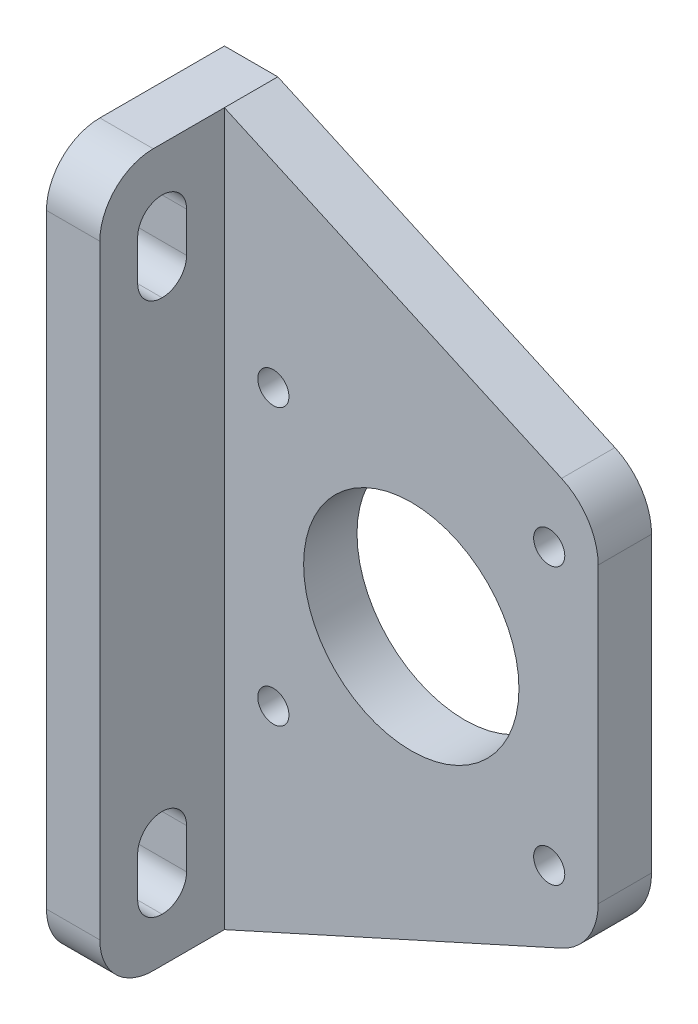
from build123d import *

# Parameters (mm, degrees)
SKETCH1_R           = 12.1
SKETCH1_R_2         = 1.75
BOSS_EXTRUDE1_DEPTH = 6
SKETCH2_R           = 3.25
CUT_EXTRUDE1_DEPTH  = 3.5
FILLET2_R           = 7
SKETCH4_W           = 6
SKETCH4_H           = 80
BOSS_EXTRUDE2_DEPTH = 20
SKETCH5_W           = 5.5
SKETCH5_H           = 10
CUT_EXTRUDE2_DEPTH  = 20
FILLET3_R           = 2.75
FILLET4_R           = 6


with BuildPart() as part:
    # Sketch1 → Boss-Extrude1 (new body)
    with BuildSketch(Plane.XY):
        Polygon((21, -21), (21, 21), (-21, 40), (-21, -40), align=None)
        Circle(SKETCH1_R, mode=Mode.SUBTRACT)
        with Locations((15.5, 15.5)):
            Circle(SKETCH1_R_2, mode=Mode.SUBTRACT)
        with Locations((15.5, -15.5)):
            Circle(SKETCH1_R_2, mode=Mode.SUBTRACT)
        with Locations((-15.5, -15.5)):
            Circle(SKETCH1_R_2, mode=Mode.SUBTRACT)
        with Locations((-15.5, 15.5)):
            Circle(SKETCH1_R_2, mode=Mode.SUBTRACT)
    extrude(amount=BOSS_EXTRUDE1_DEPTH)

    # Sketch2 → Cut-Extrude1 (cut)
    with BuildSketch(Plane(origin=(0, 0, 0), x_dir=(-1, 0, 0), z_dir=(0, 0, -1))):
        with Locations((-15.5, 15.5)):
            Circle(SKETCH2_R)
        with Locations((15.5, 15.5)):
            Circle(SKETCH2_R)
        with Locations((15.5, -15.5)):
            Circle(SKETCH2_R)
        with Locations((-15.5, -15.5)):
            Circle(SKETCH2_R)
    extrude(amount=-CUT_EXTRUDE1_DEPTH, mode=Mode.SUBTRACT)

    # Fillet2
    fillet2_edges = [part.edges().sort_by_distance(p)[0] for p in [
        (21, 21, 3),
        (21, -21, 3),
    ]]
    fillet(fillet2_edges, radius=FILLET2_R)

    # Sketch4 → Boss-Extrude2 (add)
    with BuildSketch(Plane(origin=(0, 0, 0), x_dir=(-1, 0, 0), z_dir=(0, 0, -1))):
        with Locations((24, 0)):
            Rectangle(SKETCH4_W, SKETCH4_H)
    extrude(amount=-BOSS_EXTRUDE2_DEPTH)

    # Sketch5 → Cut-Extrude2 (cut)
    with BuildSketch(Plane(origin=(-21, 0, 0), x_dir=(0, 0, -1), z_dir=(1, 0, 0))):
        with Locations((-13, -30)):
            Rectangle(SKETCH5_W, SKETCH5_H)
        with Locations((-13, 30)):
            Rectangle(SKETCH5_W, SKETCH5_H)
    extrude(amount=-CUT_EXTRUDE2_DEPTH, mode=Mode.SUBTRACT)

    # Fillet3
    fillet3_edges = [part.edges().sort_by_distance(p)[0] for p in [
        (-24, -25, 15.75),
        (-24, -25, 10.25),
        (-24, -35, 15.75),
        (-24, -35, 10.25),
        (-24, 35, 15.75),
        (-24, 25, 15.75),
        (-24, 25, 10.25),
        (-24, 35, 10.25),
    ]]
    fillet(fillet3_edges, radius=FILLET3_R - 0.0001)  # a hair under: the kernel refuses the full size

    # Fillet4
    fillet4_edges = [part.edges().sort_by_distance(p)[0] for p in [
        (-24, 40, 20),
        (-24, -40, 20),
    ]]
    fillet(fillet4_edges, radius=FILLET4_R)


solid = part.part
